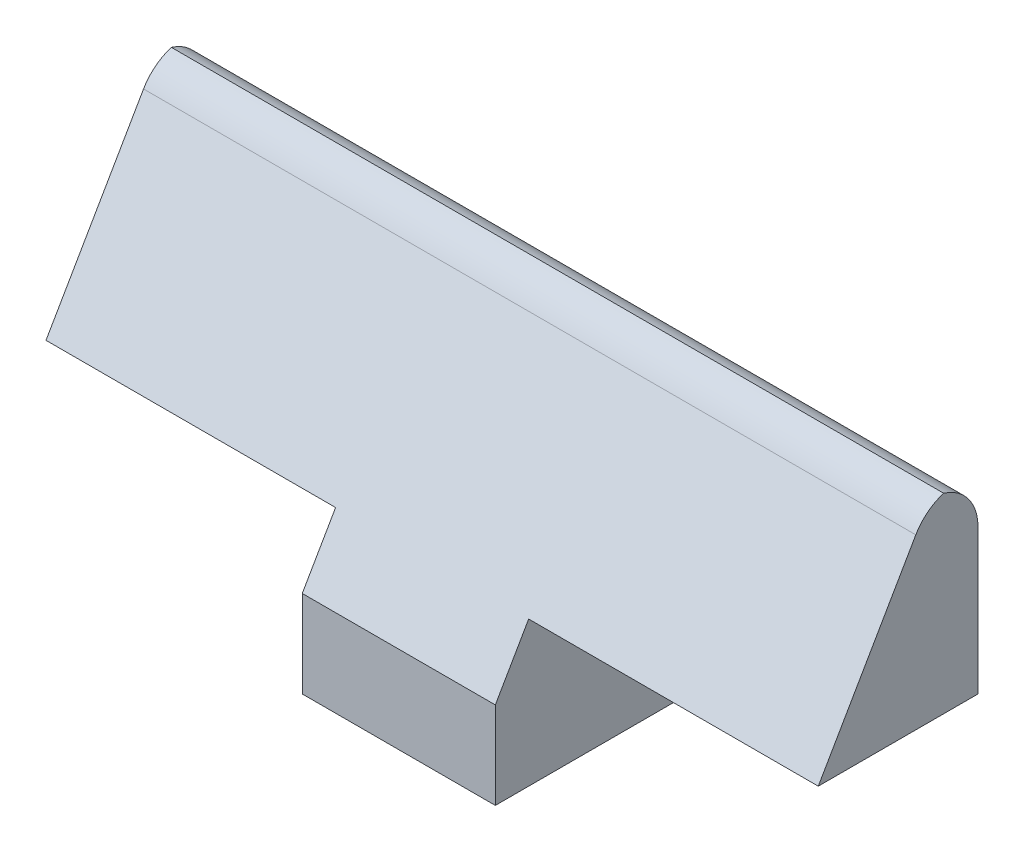
from build123d import *

# Parameters (mm, degrees)
BOSS_EXTRUDE1_DEPTH = 25.4
CHAMFER1_SIZE       = 19.05
CHAMFER1_SIZE2      = 32.995567884
FILLET1_R           = 6.35


# Read off the part's stored shape, not the designer's step: AdvancedHole1
with BuildPart() as part:
    # Sketch1 → Boss-Extrude1 (new body)
    with BuildSketch(Plane.XY):
        Polygon((0, 0), (0, 19.05), (-38.1, 19.05), (-38.1, 44.45), (63.5, 44.45), (63.5, 19.05), (25.4, 19.05), (25.4, 0), align=None)
    extrude(amount=BOSS_EXTRUDE1_DEPTH)

    # Chamfer1
    chamfer1_edges = [part.edges().sort_by_distance(p)[0] for p in [
        (12.7, 44.45, 25.4),
    ]]
    chamfer1_side = [part.faces().sort_by_distance(p)[0] for p in [
        (12.7, 44.45, 12.7),
    ]]
    chamfer(chamfer1_edges, length=CHAMFER1_SIZE, length2=CHAMFER1_SIZE2, reference=chamfer1_side[0])

    # Fillet1
    # the kernel refuses this fillet: 6.35 mm, written as the material it takes off along each edge
    with BuildSketch(Plane(origin=(-53.975, 44.45, 0), x_dir=(0, -1, 0), z_dir=(1, 0, 0))) as fillet1_piece_1:
        with BuildLine():
            CenterArc((FILLET1_R, -FILLET1_R), FILLET1_R, 90, 90)
            Line((0, -FILLET1_R), (0, 0))
            Line((0, 0), (FILLET1_R, 0))
        make_face()
    extrude(amount=133.35, mode=Mode.SUBTRACT)
    with BuildSketch(Plane(origin=(-47.265435523, 44.45, 6.35), x_dir=(0, -0.8660254037844407, 0.49999999999999656), z_dir=(1, 0, 0))) as fillet1_piece_2:
        with BuildLine():
            CenterArc((FILLET1_R * 0.57735026919, FILLET1_R), FILLET1_R, 210, 60)
            Line((-FILLET1_R * 0.288675134595, FILLET1_R * 0.5), (0, 0))
            Line((0, 0), (FILLET1_R * 0.57735026919, 0))
        make_face()
    extrude(amount=119.930871047, mode=Mode.SUBTRACT)

    # AdvancedHole1 outline → AdvancedHole1 (revolve, cut)
    with BuildSketch(Plane(origin=(12.7, 0, 12.7), x_dir=(1, 0, 0), z_dir=(0, 0, 1))):
        Polygon((8.33374, 0), (8.33374, 12.7), (0, 17.707416175), (0, 0), align=None)
    revolve(axis=Axis((12.7, 0, 12.7), (0, 1, 0)), mode=Mode.SUBTRACT)


solid = part.part
